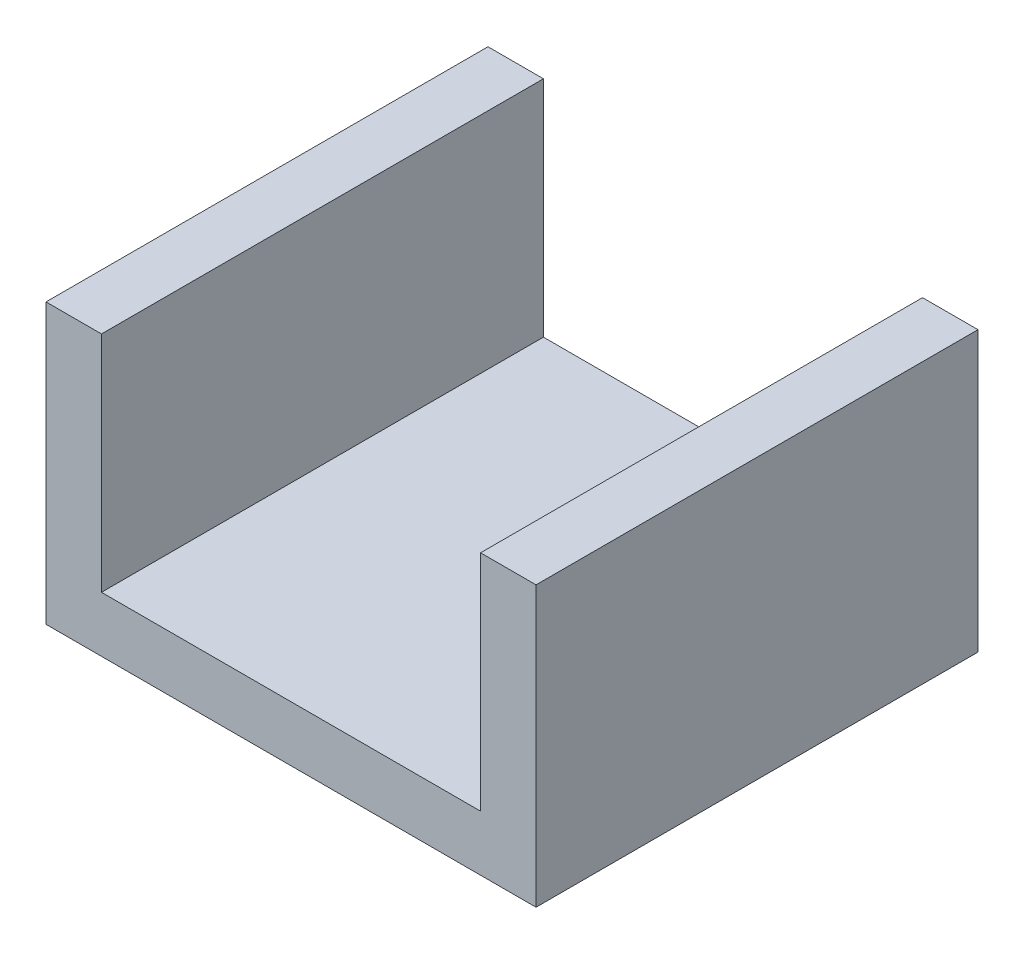
from build123d import *

# Parameters (mm, degrees)
SKETCH1_W           = 26.5
SKETCH1_H           = 23.9
BOSS_EXTRUDE1_DEPTH = 3
SKETCH1_3_W         = 3
SKETCH1_3_H         = 23.9
BOSS_EXTRUDE2_DEPTH = 15.1


with BuildPart() as part:
    # Sketch1 → Boss-Extrude1 (new body)
    with BuildSketch(Plane(origin=(0, 0, 0), x_dir=(1, 0, 0), z_dir=(0, 1, 0))):
        with Locations((10.25, -11.95)):
            Rectangle(SKETCH1_W, SKETCH1_H)
    extrude(amount=BOSS_EXTRUDE1_DEPTH)

    # Sketch1<3> → Boss-Extrude2 (add)
    with BuildSketch(Plane(origin=(0, 0, 0), x_dir=(1, 0, 0), z_dir=(0, 1, 0))):
        with Locations((-1.5, -11.95)):
            Rectangle(SKETCH1_3_W, SKETCH1_3_H)
        with Locations((22, -11.95)):
            Rectangle(SKETCH1_3_W, SKETCH1_3_H)
    extrude(amount=BOSS_EXTRUDE2_DEPTH)


solid = part.part
